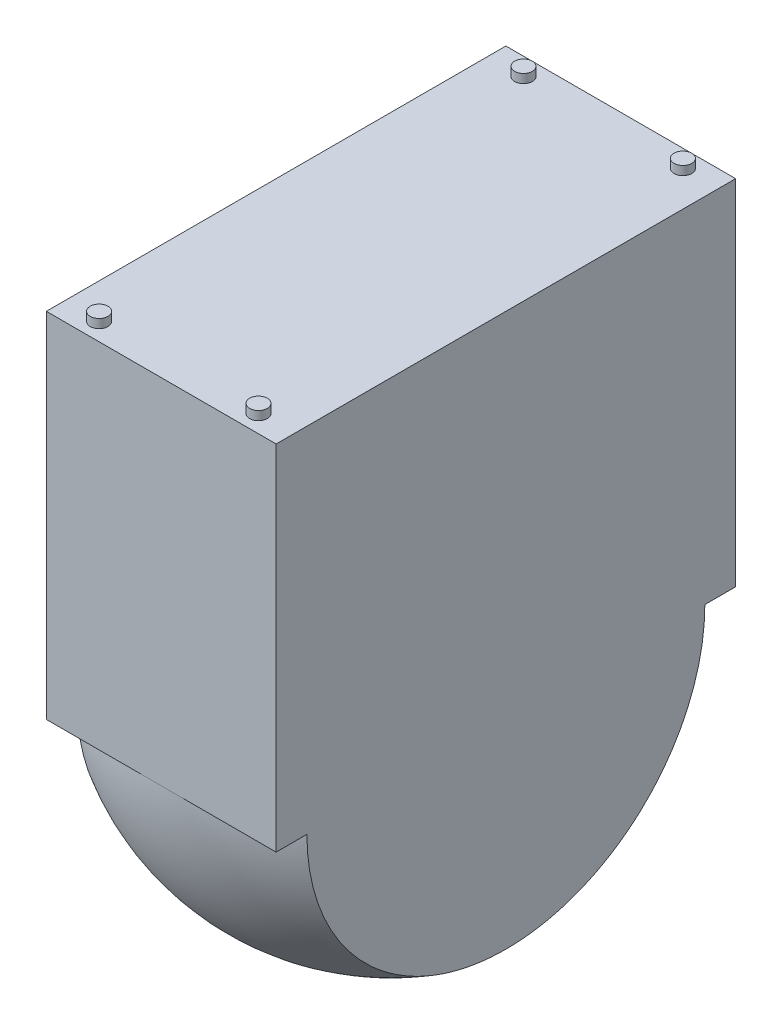
from build123d import *

# Parameters (mm, degrees)
EXTRUDE_1_DEPTH           = 200
CUT_EXTRUDE_START         = -130
CUT_EXTRUDE_1_OUTLINE_W   = 315
CUT_EXTRUDE_1_OUTLINE_H   = 262
CUT_EXTRUDE_1_DEPTH       = 65
CUT_EXTRUDE_START_2       = 65
CUT_EXTRUDE_1_2_OUTLINE_W = 315
CUT_EXTRUDE_1_2_OUTLINE_H = 262
CUT_EXTRUDE_1_2_DEPTH     = 65
SHELL_START               = 5
SHELL_1_OUTLINE_W         = 125
SHELL_1_OUTLINE_H         = 250
SHELL_1_DEPTH             = 190
EXTRUDE_7_DEPTH           = 3
SKETCH_5_R                = 5
EXTRUDE_8_DEPTH           = 5
SKETCH_6_R                = 38
SKETCH_6_R_2              = 16
EXTRUDE_9_DEPTH           = 15
SKETCH_7_R                = 10
SKETCH_7_R_2              = 5
EXTRUDE_10_DEPTH          = 15
SKETCH_8_R                = 1.5
CUT_EXTRUDE_2_DEPTH       = 10


with BuildPart() as part:
    # 草图1 → 旋转1 (revolve)
    with BuildSketch(Plane.XY):
        with BuildLine():
            Line((0, 130), (0, -130))
            ThreePointArc((0, -130), (130, 0), (0, 130))
        make_face()
    revolve(axis=Axis((0, 130, 0), (0, -1, 0)))

    # 草图3 → 凸台-拉伸1 (add)
    with BuildSketch(Plane(origin=(0, 0, 0), x_dir=(1, 0, 0), z_dir=(0, 1, 0))):
        with BuildLine():
            Line((-120, -130), (120, -130))
            ThreePointArc((120, -130), (127.071067812, -127.071067812), (130, -120))
            Line((130, -120), (130, 120))
            ThreePointArc((130, 120), (127.071067812, 127.071067812), (120, 130))
            Line((120, 130), (-120, 130))
            ThreePointArc((-120, 130), (-127.071067812, 127.071067812), (-130, 120))
            Line((-130, 120), (-130, -120))
            ThreePointArc((-130, -120), (-127.071067812, -127.071067812), (-120, -130))
        make_face()
    extrude(amount=EXTRUDE_1_DEPTH)

    # 切除-拉伸1: read off the stored shape, not the designer's step
    # 切除-拉伸1 outline → 切除-拉伸1 (cut)
    with BuildSketch(Plane.YZ.offset(CUT_EXTRUDE_START)):
        with Locations((43.5, 0)):
            Rectangle(CUT_EXTRUDE_1_OUTLINE_W, CUT_EXTRUDE_1_OUTLINE_H)
    extrude(amount=CUT_EXTRUDE_1_DEPTH, mode=Mode.SUBTRACT)

    # Cut-Extrude 1 2 outline → Cut-Extrude 1 2 (cut)
    with BuildSketch(Plane.YZ.offset(CUT_EXTRUDE_START_2)):
        with Locations((43.5, 0)):
            Rectangle(CUT_EXTRUDE_1_2_OUTLINE_W, CUT_EXTRUDE_1_2_OUTLINE_H)
    extrude(amount=CUT_EXTRUDE_1_2_DEPTH, mode=Mode.SUBTRACT)

    # 抽壳1: read off the stored shape, not the designer's step
    # 抽壳1 outline → 抽壳1 (cut)
    with BuildSketch(Plane(origin=(0, 0, 0), x_dir=(1, 0, 0), z_dir=(0, 1, 0)).offset(SHELL_START)):
        with Locations((-2.5, 0)):
            Rectangle(SHELL_1_OUTLINE_W, SHELL_1_OUTLINE_H)
    extrude(amount=SHELL_1_DEPTH, mode=Mode.SUBTRACT)

    # Shell 1 2 outline → Shell 1 2 (revolve, cut)
    with BuildSketch(Plane.YX):
        with BuildLine():
            Line((109.658560943, 60.0000001), (0, 60.000000075))
            Line((0, 60.000000075), (0, -65.0000001))
            Line((0, -65.0000001), (106.770782459, -65.0000001))
            ThreePointArc((106.770782459, -65.0000001), (124.966656288, -2.887008165), (109.658560943, 60.0000001))
        make_face()
    revolve(axis=Axis((0, 0, 0), (1, 0, 0)), mode=Mode.SUBTRACT)

    # 草图4 → 凸台-拉伸7 (add)
    with BuildSketch(Plane.ZY.offset(65)):
        with BuildLine():
            Line((-130, 135), (-130, 0))
            Line((-130, 0), (-112.249721603, 0))
            ThreePointArc((-112.249721603, 0), (0, 112.249721603), (112.249721603, 0))
            Line((112.249721603, 0), (130, 0))
            Line((130, 0), (130, 135))
            Line((130, 135), (-130, 135))
        make_face()
    extrude(amount=-EXTRUDE_7_DEPTH)

    # 草图5 → 凸台-拉伸8 (add)
    with BuildSketch(Plane(origin=(0, 200, 0), x_dir=(1, 0, 0), z_dir=(0, 1, 0))):
        with Locations(Location((-45.093986565, 120.067321952, 0), (0, 0, 270))):
            Circle(SKETCH_5_R)
        with Locations(Location((-45.093986565, -120.067321952, 0), (0, 0, 90))):
            Circle(SKETCH_5_R)
        with Locations(Location((45.093986565, -120.067321952, 0), (0, 0, 270))):
            Circle(SKETCH_5_R)
        with Locations(Location((45.093986565, 120.067321952, 0), (0, 0, 90))):
            Circle(SKETCH_5_R)
    extrude(amount=EXTRUDE_8_DEPTH)

    # 草图6 → 凸台-拉伸9 (add)
    with BuildSketch(Plane.ZY.offset(-60)):
        with Locations(Location((0, 0, 0), (0, 0, 180))):
            Circle(SKETCH_6_R)
        Circle(SKETCH_6_R_2, mode=Mode.SUBTRACT)
    extrude(amount=EXTRUDE_9_DEPTH)

    # 草图7 → 凸台-拉伸10 (add)
    with BuildSketch(Plane.ZY.offset(-60)):
        with Locations(Location((-92.612625974, 96.844728871, 0), (0, 0, 180))):
            Circle(SKETCH_7_R)
        with Locations((-92.612625974, 96.844728871)):
            Circle(SKETCH_7_R_2, mode=Mode.SUBTRACT)
    extrude(amount=EXTRUDE_10_DEPTH)

    # 草图8 → 切除-拉伸2 (cut)
    with BuildSketch(Plane(origin=(0, 0, -130), x_dir=(-1, 0, 0), z_dir=(0, 0, -1))):
        with Locations((-26.070809392, 147.850864108)):
            Circle(SKETCH_8_R)
        with Locations((-7.111216047, 147.850864108)):
            Circle(SKETCH_8_R)
        with Locations((-26.070809392, 127.113089979)):
            Circle(SKETCH_8_R)
        with Locations((-7.111216047, 127.113089979)):
            Circle(SKETCH_8_R)
    extrude(amount=-CUT_EXTRUDE_2_DEPTH, mode=Mode.SUBTRACT)


solid = part.part
